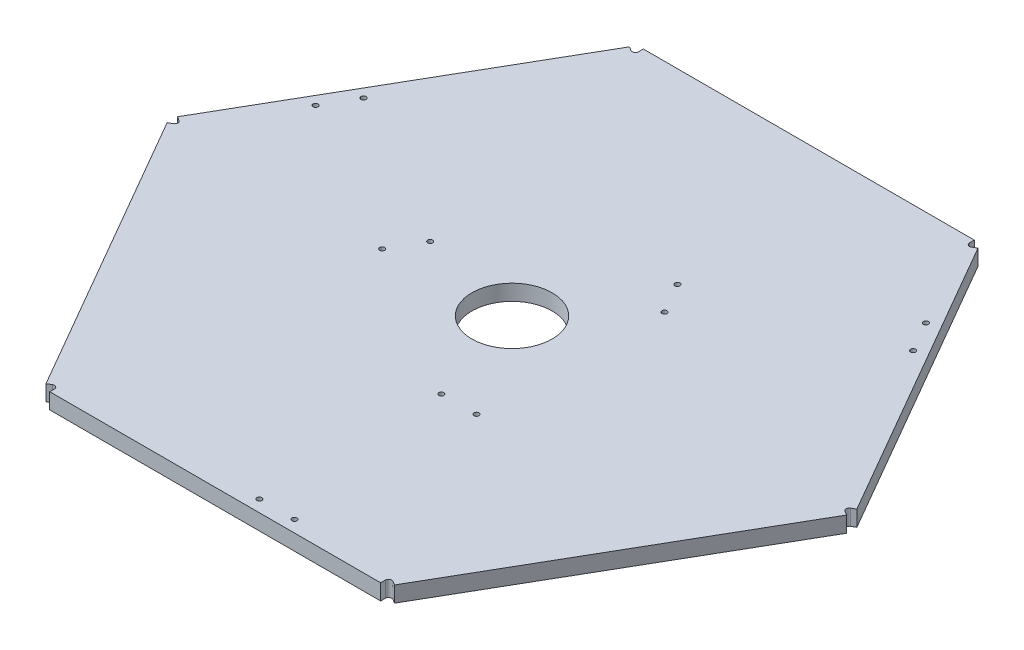
from build123d import *

# Parameters (mm, degrees)
BOSS_EXTRUDE1_DEPTH = 5
SKETCH7_R           = 1
CUT_EXTRUDE5_DEPTH  = 144.674400411
CUT_EXTRUDE6_REACH  = 145.674
SKETCH9_R           = 12.7
SKETCH13_R          = 0.8
CUT_EXTRUDE7_DEPTH  = 144.674400411
CUT_EXTRUDE8_DEPTH  = 144.674400411
CIRPATTERN1_COUNT   = 6


with BuildPart() as part:
    # Sketch1 → Boss-Extrude1 (new body)
    with BuildSketch(Plane(origin=(0, 0, 0), x_dir=(1, 0, 0), z_dir=(0, 1, 0))):
        Polygon((54.270925304, 94), (-54.270925304, 94), (-108.541850608, 0), (-54.270925304, -94), (54.270925304, -94), (108.541850608, 0), align=None)
    extrude(amount=BOSS_EXTRUDE1_DEPTH)

    # Sketch7 → Cut-Extrude5 (cut, through all)
    with BuildSketch(Plane(origin=(0, 5, 0), x_dir=(1, 0, 0), z_dir=(0, 1, 0))):
        with Locations((-53.4048999, 92.5)):
            Circle(SKETCH7_R)
    cut_extrude5 = extrude(amount=-CUT_EXTRUDE5_DEPTH, mode=Mode.SUBTRACT)

    # Sketch9 → Cut-Extrude6 (cut, up to next)
    with BuildSketch(Plane(origin=(0, 5, 0), x_dir=(1, 0, 0), z_dir=(0, 1, 0)), mode=Mode.PRIVATE) as cut_extrude6_sk1:
        Circle(SKETCH9_R)
    cut_extrude6_tool1 = extrude(cut_extrude6_sk1.sketch, amount=-CUT_EXTRUDE6_REACH, mode=Mode.PRIVATE) & part.part
    add(cut_extrude6_tool1.solids().sort_by_distance((0, 5, 0))[0], mode=Mode.SUBTRACT)

    # Sketch13 → Cut-Extrude7 (cut, through all)
    with BuildSketch(Plane(origin=(0, 5, 0), x_dir=(1, 0, 0), z_dir=(0, 1, 0))):
        with Locations((-88.840042692, 26.624532312)):
            Circle(SKETCH13_R)
        with Locations((-38.935328798, -2.187967688)):
            Circle(SKETCH13_R)
        with Locations((67.477542692, 63.625467688)):
            Circle(SKETCH13_R)
        with Locations((21.3625, -90.25)):
            Circle(SKETCH13_R)
        with Locations((-83.277542692, 36.259064929)):
            Circle(SKETCH13_R)
        with Locations((-33.372828798, 7.446564929)):
            Circle(SKETCH13_R)
        with Locations((73.040042692, 53.990935071)):
            Circle(SKETCH13_R)
        with Locations((17.572828798, 34.812967688)):
            Circle(SKETCH13_R)
        with Locations((23.135328798, 25.178435071)):
            Circle(SKETCH13_R)
        with Locations((10.2375, -90.25)):
            Circle(SKETCH13_R)
        with Locations((21.3625, -32.625)):
            Circle(SKETCH13_R)
        with Locations((10.2375, -32.625)):
            Circle(SKETCH13_R)
    extrude(amount=-CUT_EXTRUDE7_DEPTH, mode=Mode.SUBTRACT)

    # Sketch17 → Cut-Extrude8 (cut, through all)
    with BuildSketch(Plane(origin=(0, 5, 0), x_dir=(1, 0, 0), z_dir=(0, 1, 0))):
        with BuildLine():
            Line((-52.4048999, 92.5), (-52.4048999, 94))
            Line((-52.4048999, 94), (-54.270925304, 94))
            Line((-54.270925304, 94), (-55.203938006, 92.383974596))
            Line((-55.203938006, 92.383974596), (-53.9048999, 91.633974596))
            ThreePointArc((-53.9048999, 91.633974596), (-52.9048999, 91.633974596), (-52.4048999, 92.5))
        make_face()
    cut_extrude8 = extrude(amount=-CUT_EXTRUDE8_DEPTH, mode=Mode.SUBTRACT)

    # CirPattern1: Cut-Extrude5, Cut-Extrude8 ×6 about axis
    cirpattern1_axis = Axis((0, 5, 0), (0, 1, 0))
    add([cut_extrude5.rotate(cirpattern1_axis, i * 360 / CIRPATTERN1_COUNT) for i in range(1, CIRPATTERN1_COUNT)], mode=Mode.SUBTRACT)
    add([cut_extrude8.rotate(cirpattern1_axis, i * 360 / CIRPATTERN1_COUNT) for i in range(1, CIRPATTERN1_COUNT)], mode=Mode.SUBTRACT)


solid = part.part
